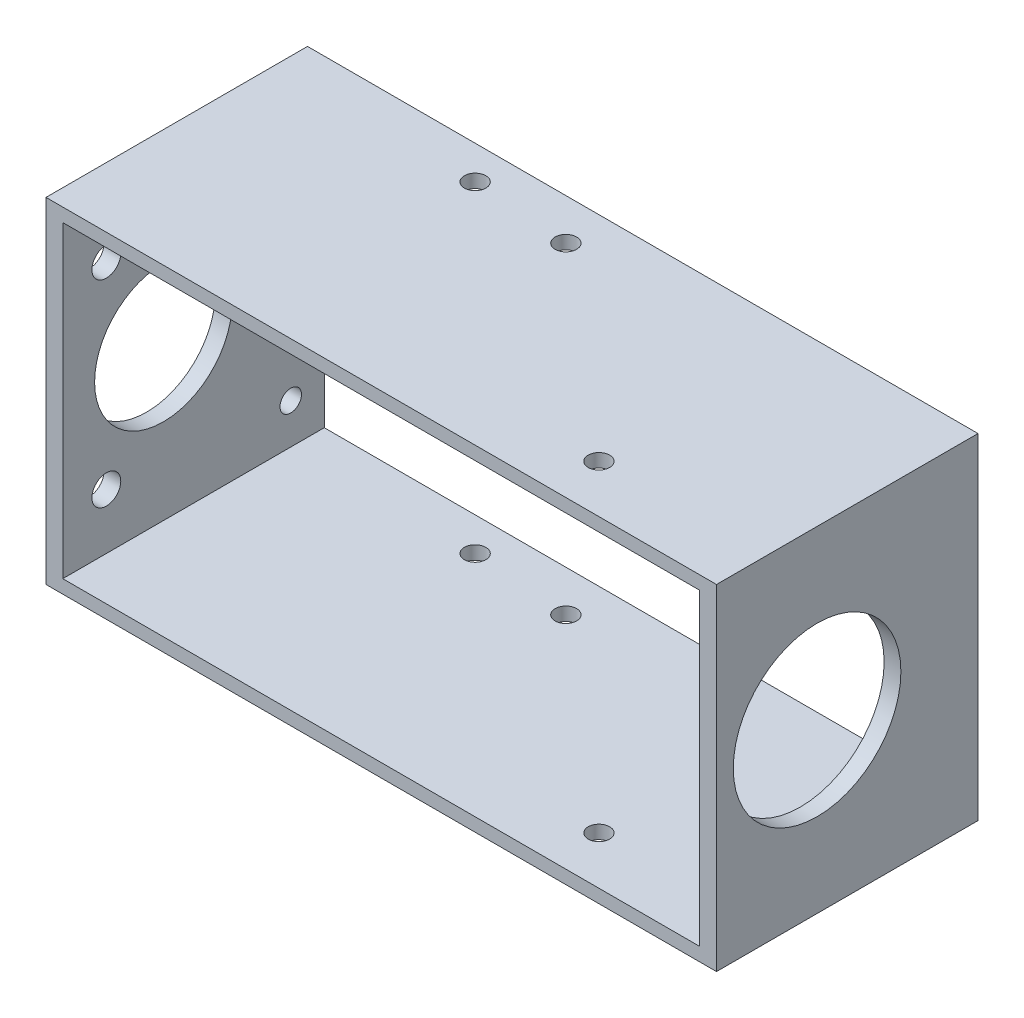
from build123d import *

# Parameters (mm, degrees)
SKETCH_1_W          = 100
SKETCH_1_H          = 50
SKETCH_1_W_2        = 95
SKETCH_1_H_2        = 46
EXTRUDE_1_DEPTH     = 19.5
SKETCH_2_R          = 1.6
CUT_EXTRUDE_1_DEPTH = 74.350187457
CUT_EXTRUDE_2_REACH = 106.906
SKETCH_3_R          = 10.25
SKETCH_3_R_2        = 2.15
SKETCH_3_R_3        = 1.6
CUT_EXTRUDE_3_REACH = 106.906
SKETCH_4_R          = 12.5


with BuildPart() as part:
    # ｽｹｯﾁ1 → ﾎﾞｽ - 押し出し1 (new, symmetric)
    with BuildSketch(Plane.XY):
        Rectangle(SKETCH_1_W, SKETCH_1_H)
        Rectangle(SKETCH_1_W_2, SKETCH_1_H_2, mode=Mode.SUBTRACT)
    extrude(amount=EXTRUDE_1_DEPTH, both=True)

    # ｽｹｯﾁ2 → ｶｯﾄ - 押し出し1 (cut, through all)
    with BuildSketch(Plane(origin=(0, 25, 0), x_dir=(1, 0, 0), z_dir=(0, 1, 0))):
        with Locations((-5.320888862, 13.355752194)):
            Circle(SKETCH_2_R)
        with Locations((25.320888862, -12.355752194)):
            Circle(SKETCH_2_R)
        with Locations((-20, 14.5)):
            Circle(SKETCH_2_R)
    extrude(amount=-CUT_EXTRUDE_1_DEPTH, mode=Mode.SUBTRACT)

    # ｽｹｯﾁ3 → ｶｯﾄ - 押し出し2 (cut, up to next)
    with BuildSketch(Plane.ZY.offset(50), mode=Mode.PRIVATE) as cut_extrude_2_sk1:
        with Locations((4.5, 0)):
            Circle(SKETCH_3_R)
    cut_extrude_2_tool1 = extrude(cut_extrude_2_sk1.sketch, amount=-CUT_EXTRUDE_2_REACH, mode=Mode.PRIVATE) & part.part
    # ｽｹｯﾁ3 → ｶｯﾄ - 押し出し2 (cut, up to next)
    with BuildSketch(Plane.ZY.offset(50), mode=Mode.PRIVATE) as cut_extrude_2_sk2:
        with Locations((-12.5, 0)):
            Circle(SKETCH_3_R_2)
    cut_extrude_2_tool2 = extrude(cut_extrude_2_sk2.sketch, amount=-CUT_EXTRUDE_2_REACH, mode=Mode.PRIVATE) & part.part
    # ｽｹｯﾁ3 → ｶｯﾄ - 押し出し2 (cut, up to next)
    with BuildSketch(Plane.ZY.offset(50), mode=Mode.PRIVATE) as cut_extrude_2_sk3:
        with Locations((13, 14.722431864)):
            Circle(SKETCH_3_R_2)
    cut_extrude_2_tool3 = extrude(cut_extrude_2_sk3.sketch, amount=-CUT_EXTRUDE_2_REACH, mode=Mode.PRIVATE) & part.part
    # ｽｹｯﾁ3 → ｶｯﾄ - 押し出し2 (cut, up to next)
    with BuildSketch(Plane.ZY.offset(50), mode=Mode.PRIVATE) as cut_extrude_2_sk4:
        with Locations((13, -14.722431864)):
            Circle(SKETCH_3_R_2)
    cut_extrude_2_tool4 = extrude(cut_extrude_2_sk4.sketch, amount=-CUT_EXTRUDE_2_REACH, mode=Mode.PRIVATE) & part.part
    # ｽｹｯﾁ3 → ｶｯﾄ - 押し出し2 (cut, up to next)
    with BuildSketch(Plane.ZY.offset(50), mode=Mode.PRIVATE) as cut_extrude_2_sk5:
        with Locations((-14.5, -17)):
            Circle(SKETCH_3_R_3)
    cut_extrude_2_tool5 = extrude(cut_extrude_2_sk5.sketch, amount=-CUT_EXTRUDE_2_REACH, mode=Mode.PRIVATE) & part.part
    # ｽｹｯﾁ3 → ｶｯﾄ - 押し出し2 (cut, up to next)
    with BuildSketch(Plane.ZY.offset(50), mode=Mode.PRIVATE) as cut_extrude_2_sk6:
        with Locations((-14.5, 17)):
            Circle(SKETCH_3_R_3)
    cut_extrude_2_tool6 = extrude(cut_extrude_2_sk6.sketch, amount=-CUT_EXTRUDE_2_REACH, mode=Mode.PRIVATE) & part.part
    add(cut_extrude_2_tool1.solids().sort_by_distance((-50, 0, 4.5))[0], mode=Mode.SUBTRACT)
    add(cut_extrude_2_tool2.solids().sort_by_distance((-50, 0, -12.5))[0], mode=Mode.SUBTRACT)
    add(cut_extrude_2_tool3.solids().sort_by_distance((-50, 14.722432, 13))[0], mode=Mode.SUBTRACT)
    add(cut_extrude_2_tool4.solids().sort_by_distance((-50, -14.722432, 13))[0], mode=Mode.SUBTRACT)
    add(cut_extrude_2_tool5.solids().sort_by_distance((-50, -17, -14.5))[0], mode=Mode.SUBTRACT)
    add(cut_extrude_2_tool6.solids().sort_by_distance((-50, 17, -14.5))[0], mode=Mode.SUBTRACT)

    # ｽｹｯﾁ4 → ｶｯﾄ - 押し出し3 (cut, up to next)
    with BuildSketch(Plane(origin=(50, 0, 0), x_dir=(0, 0, -1), z_dir=(1, 0, 0)), mode=Mode.PRIVATE) as cut_extrude_3_sk1:
        with Locations((-4.5, 0)):
            Circle(SKETCH_4_R)
    cut_extrude_3_tool1 = extrude(cut_extrude_3_sk1.sketch, amount=-CUT_EXTRUDE_3_REACH, mode=Mode.PRIVATE) & part.part
    add(cut_extrude_3_tool1.solids().sort_by_distance((50, 0, 4.5))[0], mode=Mode.SUBTRACT)


solid = part.part
